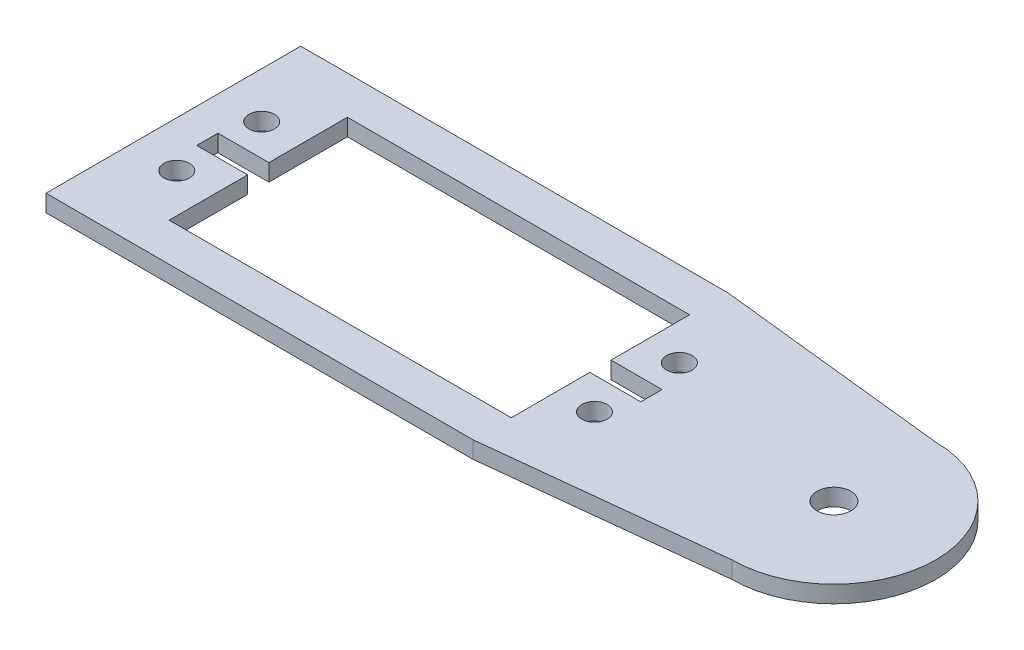
from build123d import *

# Parameters (mm, degrees)
SKETCH_1_R             = 1.5
SKETCH_1_R_2           = 2
SKETCH_1_W             = 40.3
SKETCH_1_H             = 21
EXTRUDE_1102_DEPTH     = 2
CUT_EXTRUDE_1459_REACH = 93.066
SKETCH1_W              = 6
SKETCH1_H              = 2.5


with BuildPart() as part:
    # Эскиз1 → Extrude 1102 (new body)
    with BuildSketch(Plane(origin=(0, 0, 0), x_dir=(1, 0, 0), z_dir=(0, 1, 0))):
        with BuildLine():
            Line((0, 15), (50.3, 15))
            Line((50.3, 15), (77.8, 12))
            ThreePointArc((77.8, 12), (89.8, 0), (77.8, -12))
            Line((77.8, -12), (50.3, -15))
            Line((50.3, -15), (0, -15))
            Line((0, -15), (0, 15))
        make_face()
        with Locations((5.4, -5)):
            Circle(SKETCH_1_R, mode=Mode.SUBTRACT)
        with Locations((5.4, 5)):
            Circle(SKETCH_1_R, mode=Mode.SUBTRACT)
        with Locations((54.6, -5)):
            Circle(SKETCH_1_R, mode=Mode.SUBTRACT)
        with Locations((54.6, 5)):
            Circle(SKETCH_1_R, mode=Mode.SUBTRACT)
        with Locations((77.8, 0)):
            Circle(SKETCH_1_R_2, mode=Mode.SUBTRACT)
        with Locations((30.15, 0)):
            Rectangle(SKETCH_1_W, SKETCH_1_H, mode=Mode.SUBTRACT)
    extrude(amount=EXTRUDE_1102_DEPTH)

    # Sketch1 → Cut-Extrude 1459 (cut, up to next)
    with BuildSketch(Plane(origin=(0, 2, 0), x_dir=(1, 0, 0), z_dir=(0, 1, 0)), mode=Mode.PRIVATE) as cut_extrude_1459_sk1:
        with Locations((7, 0)):
            Rectangle(SKETCH1_W, SKETCH1_H)
    cut_extrude_1459_tool1 = extrude(cut_extrude_1459_sk1.sketch, amount=-CUT_EXTRUDE_1459_REACH, mode=Mode.PRIVATE) & part.part
    # Sketch1 → Cut-Extrude 1459 (cut, up to next)
    with BuildSketch(Plane(origin=(0, 2, 0), x_dir=(1, 0, 0), z_dir=(0, 1, 0)), mode=Mode.PRIVATE) as cut_extrude_1459_sk2:
        with Locations((53.3, 0)):
            Rectangle(SKETCH1_W, SKETCH1_H)
    cut_extrude_1459_tool2 = extrude(cut_extrude_1459_sk2.sketch, amount=-CUT_EXTRUDE_1459_REACH, mode=Mode.PRIVATE) & part.part
    add(cut_extrude_1459_tool1.solids().sort_by_distance((7, 2, 0))[0], mode=Mode.SUBTRACT)
    add(cut_extrude_1459_tool2.solids().sort_by_distance((53.3, 2, 0))[0], mode=Mode.SUBTRACT)


solid = part.part
